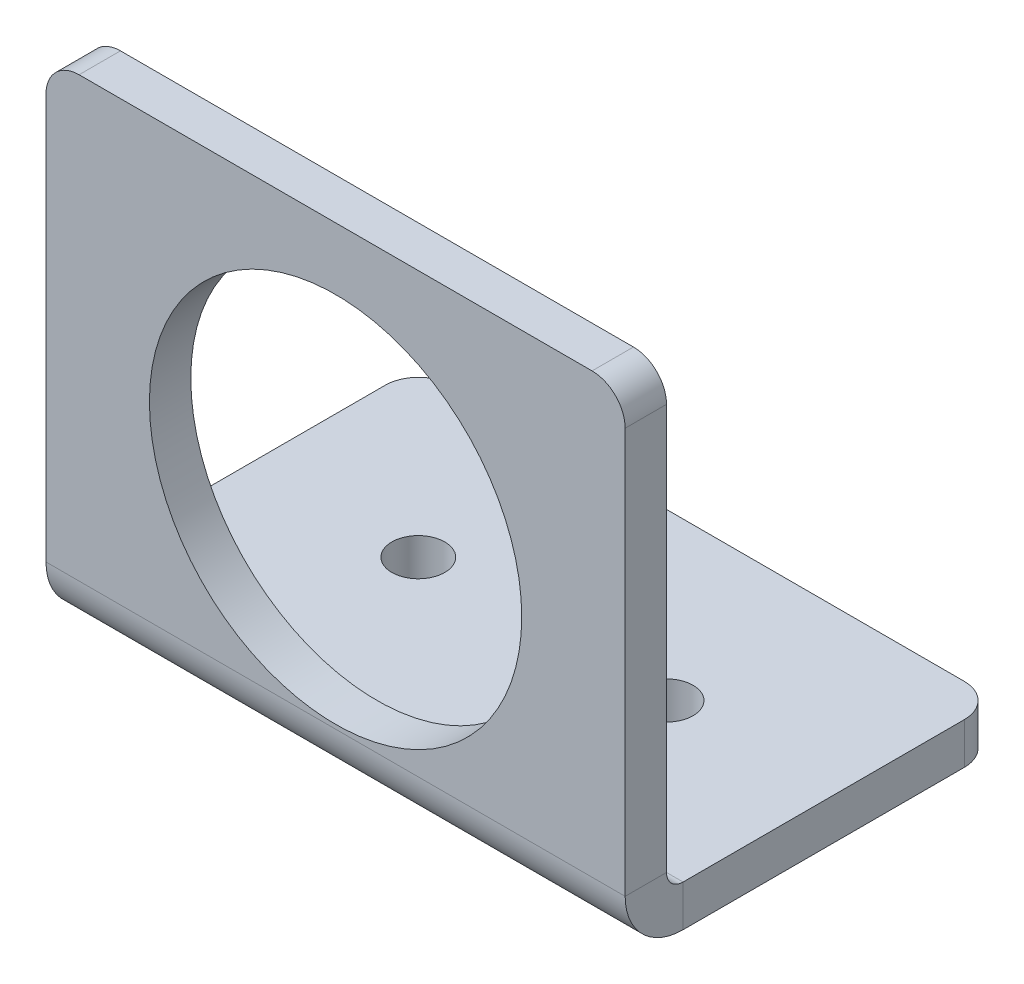
from build123d import *

# Parameters (mm, degrees)
SKETCH2_R              = 14.2875
BOSS_EXTRUDE1_DEPTH    = 3.175
SKETCH3_W              = 44.45
SKETCH3_H              = 3.175
BOSS_EXTRUDE2_DEPTH    = 25.4
SKETCH4_R              = 2.032
CUT_EXTRUDE1_DEPTH     = 25.4
FILLET1_R              = 2.54
CONVERT_SOLID1_START   = -22.225
CONVERT_SOLID1_DEPTH   = 44.45
CONVERT_SOLID1_2_DEPTH = 44.45


# Read off the part's stored shape, not the designer's step: Convert-Solid1
with BuildPart() as part:
    # Sketch2 → Boss-Extrude1 (new body)
    with BuildSketch(Plane.XY):
        with BuildLine():
            Line((-22.225, -19.05), (22.225, -19.05))
            Line((22.225, -19.05), (22.225, 16.51))
            ThreePointArc((22.225, 16.51), (21.481051224, 18.306051224), (19.685, 19.05))
            Line((19.685, 19.05), (-19.685, 19.05))
            ThreePointArc((-19.685, 19.05), (-21.481051224, 18.306051224), (-22.225, 16.51))
            Line((-22.225, 16.51), (-22.225, -19.05))
        make_face()
        Circle(SKETCH2_R, mode=Mode.SUBTRACT)
    extrude(amount=BOSS_EXTRUDE1_DEPTH)

    # Sketch3 → Boss-Extrude2 (add)
    with BuildSketch(Plane(origin=(0, 0, 0), x_dir=(-1, 0, 0), z_dir=(0, 0, -1))):
        with Locations((0, -17.4625)):
            Rectangle(SKETCH3_W, SKETCH3_H)
    extrude(amount=BOSS_EXTRUDE2_DEPTH)

    # Sketch4 → Cut-Extrude1 (cut)
    with BuildSketch(Plane(origin=(0, -15.875, 0), x_dir=(1, 0, 0), z_dir=(0, 1, 0))):
        with Locations(Location((-9.525, 12.7, 0), (0, 0, 270))):
            Circle(SKETCH4_R)
        with Locations(Location((9.525, 12.7, 0), (0, 0, 270))):
            Circle(SKETCH4_R)
    extrude(amount=-CUT_EXTRUDE1_DEPTH, mode=Mode.SUBTRACT)

    # Fillet1
    fillet1_edges = [part.edges().sort_by_distance(p)[0] for p in [
        (22.225, -17.4625, -25.4),
        (-22.225, -17.4625, -25.4),
    ]]
    fillet(fillet1_edges, radius=FILLET1_R)

    # Convert-Solid1 outline → Convert-Solid1 (cut)
    with BuildSketch(Plane.YZ.offset(CONVERT_SOLID1_START)):
        with BuildLine():
            ThreePointArc((-19.05, -1.27), (-17.748089642, 1.873089642), (-14.605, 3.175))
            Line((-14.605, 3.175), (-19.05, 3.175))
            Line((-19.05, 3.175), (-19.05, -1.27))
        make_face()
    extrude(amount=CONVERT_SOLID1_DEPTH, mode=Mode.SUBTRACT)

    # Convert-Solid1 2 outline → Convert-Solid1 2 (add)
    with BuildSketch(Plane.YZ.offset(CONVERT_SOLID1_START)):
        with BuildLine():
            ThreePointArc((-15.875, -1.27), (-15.503025612, -0.371974388), (-14.605, 0))
            Line((-14.605, 0), (-15.875, 0))
            Line((-15.875, 0), (-15.875, -1.27))
        make_face()
    extrude(amount=CONVERT_SOLID1_2_DEPTH)


solid = part.part
